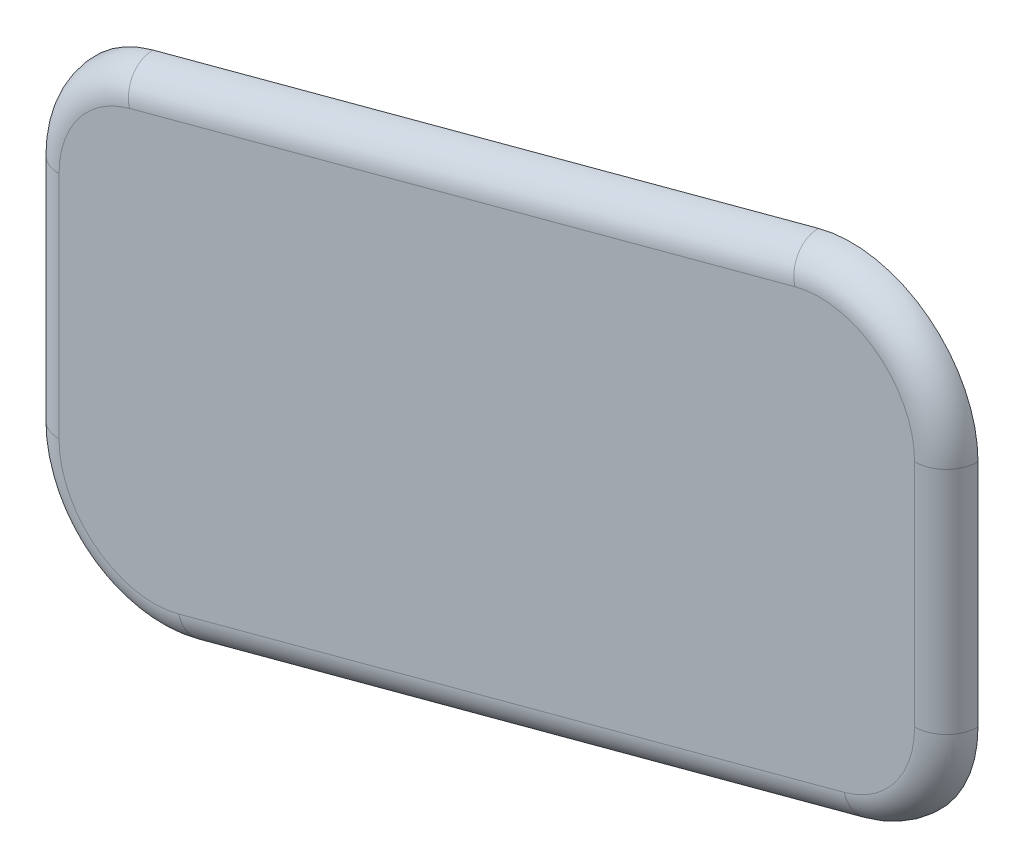
from build123d import *

# Parameters (mm, degrees)
EXTRUDE_1_DEPTH = 1
FILLET_1_R      = 4
FILLET_2_R      = 1


with BuildPart() as part:
    # Эскиз1 → Бобышка-Вытянуть1 (new body)
    with BuildSketch(Plane.XY):
        Polygon((0, 0), (29, 7.770526581), (29, 23.299669287), (0, 15.529142706), align=None)
    extrude(amount=EXTRUDE_1_DEPTH)

    # Скругление1
    fillet_1_edges = [part.edges().sort_by_distance(p)[0] for p in [
        (0, 15.529142706, 0.5),
        (29, 23.299669287, 0.5),
        (29, 7.770526581, 0.5),
        (0, 0, 0.5),
    ]]
    fillet(fillet_1_edges, radius=FILLET_1_R)

    # Скругление2
    fillet_2_edges = [part.edges().sort_by_distance(p)[0] for p in [
        (27.435045716, 21.260181156, 1),
        (29, 14.463301164, 1),
        (28.173413361, 8.404788816, 1),
        (15.53527618, 4.162664707, 1),
        (1.564954284, 2.03948813, 1),
        (0, 8.836368123, 1),
        (0.826586639, 14.89488047, 1),
        (13.46472382, 19.13700458, 1),
    ]]
    fillet(fillet_2_edges, radius=FILLET_2_R - 0.0001)  # a hair under: the kernel refuses the full size


solid = part.part
